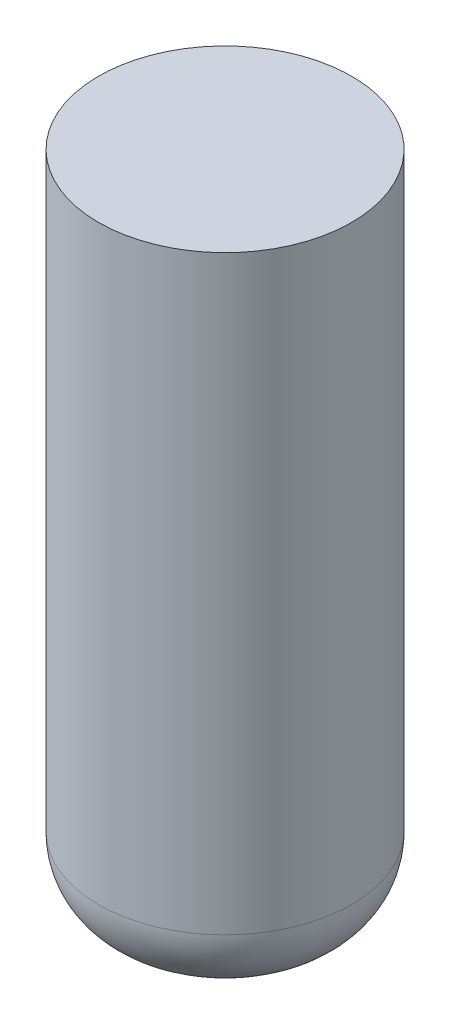
from build123d import *

# Parameters (mm, degrees)
SKETCH1_R           = 2.1
BOSS_EXTRUDE1_DEPTH = 11
FILLET2_R           = 1.2


with BuildPart() as part:
    # Sketch1 → Boss-Extrude1 (new body)
    with BuildSketch(Plane(origin=(0, 0, 0), x_dir=(1, 0, 0), z_dir=(0, 1, 0))):
        Circle(SKETCH1_R)
    extrude(amount=BOSS_EXTRUDE1_DEPTH)

    # Fillet2
    fillet2_edges = [part.edges().sort_by_distance(p)[0] for p in [
        (-2.1, 0, 0),
    ]]
    fillet(fillet2_edges, radius=FILLET2_R)


solid = part.part
